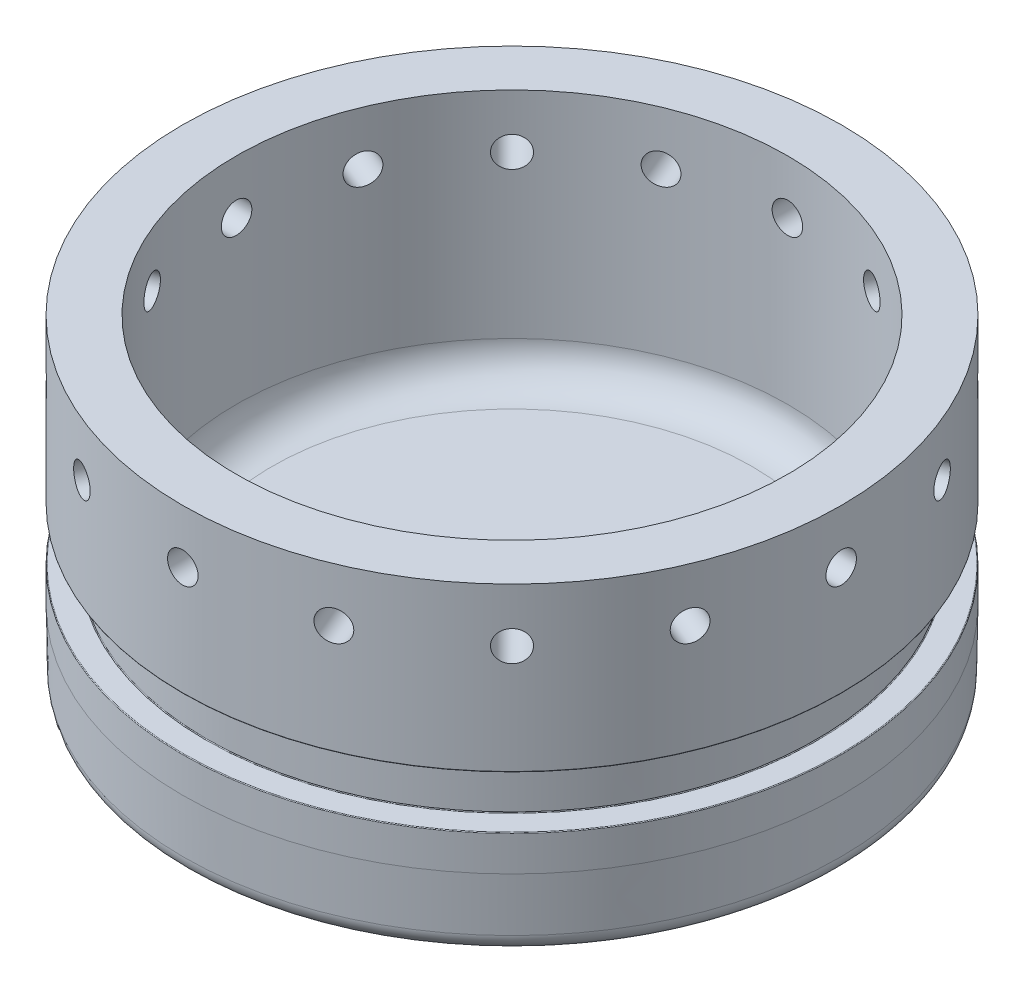
from build123d import *

# Parameters (mm, degrees)
POCKETFILLET_R              = 6.35
TAPERFILLET_R               = 3.175
FILLET3_R                   = 0.127
TAP_DRILL_FOR_1_4_28_TAP1_D = 5.4102
HOLEPATTERN_COUNT           = 16


with BuildPart() as part:
    # Sketch1 → Revolve1 (revolve)
    with BuildSketch(Plane.XY):
        Polygon((0, 3.175), (0.221679325, -9.525), (58.4454, -9.525), (58.4454, 3.175), (9.525, 3.175), (9.525, 47.7012), (0, 47.7012), (0, 18.796), (4.318, 18.796), (4.318, 9.525), (0, 9.525), align=None)
    revolve(axis=Axis((58.4454, -9.525, 0), (0, 1, 0)))

    # PocketFillet
    pocketfillet_edges = [part.edges().sort_by_distance(p)[0] for p in [
        (107.3658, 3.175, 0),
    ]]
    fillet(pocketfillet_edges, radius=POCKETFILLET_R)

    # TaperFillet
    taperfillet_edges = [part.edges().sort_by_distance(p)[0] for p in [
        (116.669120675, -9.525, 0),
    ]]
    fillet(taperfillet_edges, radius=TAPERFILLET_R)

    # Fillet3
    fillet3_edges = [part.edges().sort_by_distance(p)[0] for p in [
        (116.8908, 9.525, 0),
        (112.5728, 9.525, 0),
        (112.5728, 18.796, 0),
        (116.8908, 18.796, 0),
    ]]
    fillet(fillet3_edges, radius=FILLET3_R)

    # Tap Drill for 1/4-28 Tap1 (through all)
    with Locations(Plane.XY.offset(58.4454)):
        with Locations((58.4454, 38.1762)):
            tap_drill_for_1_4_28_tap1 = Hole(TAP_DRILL_FOR_1_4_28_TAP1_D / 2)

    # HolePattern: Tap Drill for 1/4-28 Tap1 ×16 about axis
    holepattern_axis = Axis((58.4454, 47.7012, 0), (0, -1, 0))
    for i in range(1, HOLEPATTERN_COUNT):
        add(tap_drill_for_1_4_28_tap1.rotate(holepattern_axis, i * 360 / HOLEPATTERN_COUNT), mode=Mode.SUBTRACT)


solid = part.part
